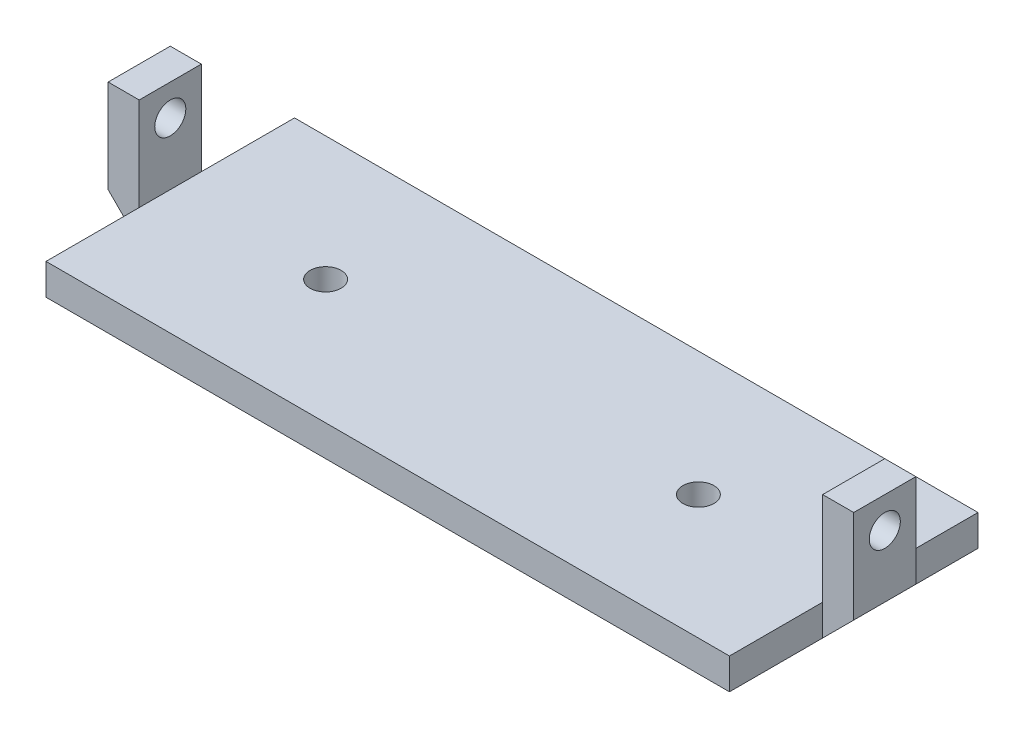
from build123d import *

# Parameters (mm, degrees)
SKETCH1_W           = 120
SKETCH1_H           = 85
BOSS_EXTRUDE1_DEPTH = 5
SKETCH2_W           = 5
SKETCH2_H           = 10
BOSS_EXTRUDE2_DEPTH = 15
SKETCH3_R           = 2.5
CUT_EXTRUDE1_DEPTH  = 129.865239689
SKETCH5_W           = 5
SKETCH5_H           = 25
SKETCH5_H_2         = 15
CUT_EXTRUDE2_DEPTH  = 76.041655099
CHAMFER1_SIZE       = 5
SKETCH6_W           = 120
SKETCH6_H           = 35
SKETCH6_W_2         = 110
SKETCH6_H_2         = 10
CUT_EXTRUDE3_DEPTH  = 77.198753271
SKETCH7_R           = 2.5
CUT_EXTRUDE4_DEPTH  = 10


with BuildPart() as part:
    # Sketch1 → Boss-Extrude1 (new body)
    with BuildSketch(Plane(origin=(0, 0, 0), x_dir=(1, 0, 0), z_dir=(0, 1, 0))):
        Rectangle(SKETCH1_W, SKETCH1_H)
    extrude(amount=BOSS_EXTRUDE1_DEPTH)

    # Sketch2 → Boss-Extrude2 (add)
    with BuildSketch(Plane(origin=(0, 5, 0), x_dir=(1, 0, 0), z_dir=(0, 1, 0))):
        with Locations((-57.5, 12.5)):
            Rectangle(SKETCH2_W, SKETCH2_H)
        with Locations((-57.5, -12.5)):
            Rectangle(SKETCH2_W, SKETCH2_H)
        with Locations((57.5, -12.5)):
            Rectangle(SKETCH2_W, SKETCH2_H)
        with Locations((57.5, 12.5)):
            Rectangle(SKETCH2_W, SKETCH2_H)
    extrude(amount=BOSS_EXTRUDE2_DEPTH)

    # Sketch3 → Cut-Extrude1 (cut, through all)
    with BuildSketch(Plane.ZY.offset(60)):
        with Locations((-12.5, 15)):
            Circle(SKETCH3_R)
        with Locations((12.5, 15)):
            Circle(SKETCH3_R)
    extrude(amount=-CUT_EXTRUDE1_DEPTH, mode=Mode.SUBTRACT)

    # Sketch5 → Cut-Extrude2 (cut, through all)
    with BuildSketch(Plane(origin=(0, 5, 0), x_dir=(1, 0, 0), z_dir=(0, 1, 0))):
        with Locations((-57.5, 30)):
            Rectangle(SKETCH5_W, SKETCH5_H)
        with Locations((-57.5, 0)):
            Rectangle(SKETCH5_W, SKETCH5_H_2)
        with Locations((-57.5, -30)):
            Rectangle(SKETCH5_W, SKETCH5_H)
        with Locations((57.5, -30)):
            Rectangle(SKETCH5_W, SKETCH5_H)
        with Locations((57.5, 0)):
            Rectangle(SKETCH5_W, SKETCH5_H_2)
        with Locations((57.5, 30)):
            Rectangle(SKETCH5_W, SKETCH5_H)
    extrude(amount=-CUT_EXTRUDE2_DEPTH, mode=Mode.SUBTRACT)

    # Chamfer1
    chamfer1_edges = [part.edges().sort_by_distance(p)[0] for p in [
        (-60, 0, 12.5),
        (-60, 0, -12.5),
        (60, 0, -12.5),
        (60, 0, 12.5),
    ]]
    chamfer(chamfer1_edges, length=CHAMFER1_SIZE)

    # Sketch6 → Cut-Extrude3 (cut, through all)
    with BuildSketch(Plane.XZ):
        with Locations((0, -25)):
            Rectangle(SKETCH6_W, SKETCH6_H)
        with Locations((0, 37.5)):
            Rectangle(SKETCH6_W_2, SKETCH6_H_2)
    extrude(amount=-CUT_EXTRUDE3_DEPTH, mode=Mode.SUBTRACT)

    # Sketch7 → Cut-Extrude4 (cut)
    with BuildSketch(Plane.XZ):
        with Locations((-30, 12.5)):
            Circle(SKETCH7_R)
        with Locations((30, 12.5)):
            Circle(SKETCH7_R)
    extrude(amount=-CUT_EXTRUDE4_DEPTH, mode=Mode.SUBTRACT)


solid = part.part
